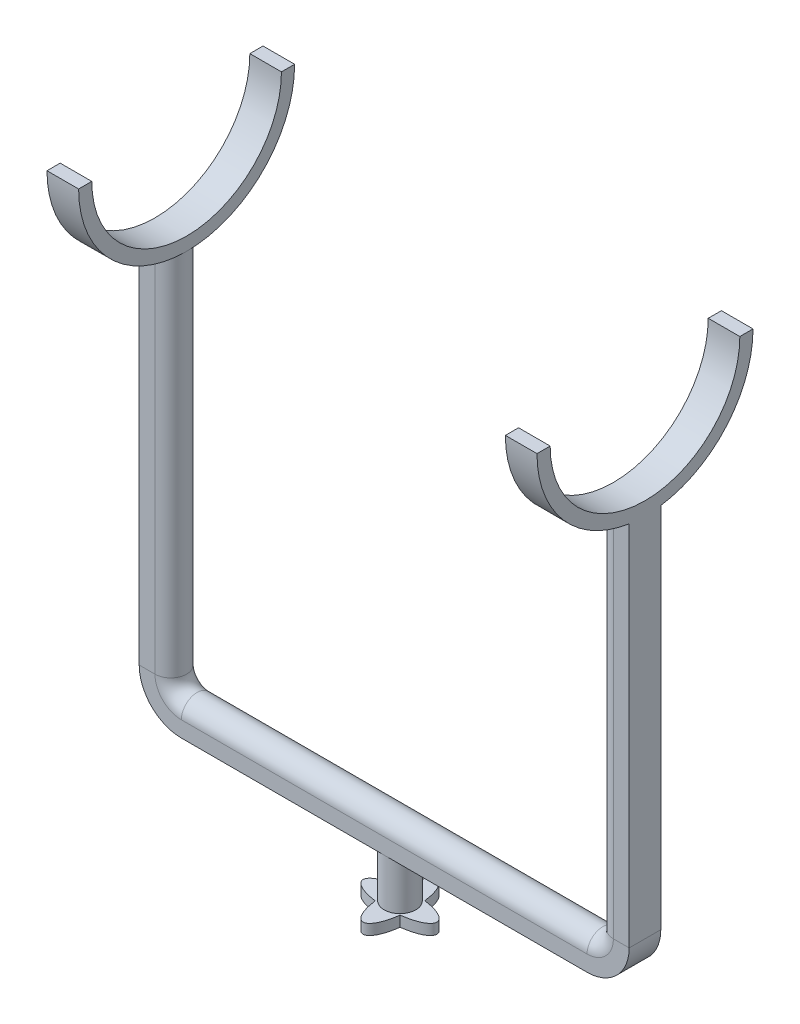
from build123d import *

# Parameters (mm, degrees)
BOSS_EXTRUDE3_DEPTH             = 2
SKETCH3_R                       = 3
BOSS_EXTRUDE4_DEPTH             = 9
BOSS_EXTRUDE5_DEPTH             = 38.5
BOSS_EXTRUDE5_DEPTH_BACK        = 38.5
SWEEP2_START                    = 11
SWEEP2_DEPTH                    = 78
SWEEP2_2_DEPTH                  = 8
SWEEP2_START_2                  = -4
SWEEP2_3_DEPTH                  = 8
SWEEP4_START                    = 11
SWEEP4_DEPTH                    = 78
SWEEP4_2_DEPTH                  = 8
SWEEP4_START_2                  = -4
SWEEP4_3_DEPTH                  = 8
BOSS_EXTRUDE6_DEPTH             = 3
BOSS_EXTRUDE6_DIRECTION_2_REACH = 128.768
BOSS_EXTRUDE7_DEPTH             = 3
BOSS_EXTRUDE7_DEPTH_BACK        = 3


with BuildPart() as part:
    # Sketch2 → Boss-Extrude3 (new body)
    with BuildSketch(Plane(origin=(0, 0, 0), x_dir=(1, 0, 0), z_dir=(0, 1, 0))):
        with BuildLine():
            add(Edge.make_bspline(
                [(-2.354354779, -2.354354779), (0, -20.812496246), (2.354354779, -2.354354779)],
                knots=[5.055412921, 5.055412921, 5.055412921, 7.510957694, 7.510957694, 7.510957694], degree=2, weights=[1, 0.336336397, 1]))
            add(Edge.make_bspline(
                [(2.354354779, -2.354354779), (20.812496246, 0), (2.354354779, 2.354354779)],
                knots=[1.913820267, 1.913820267, 1.913820267, 4.36936504, 4.36936504, 4.36936504], degree=2, weights=[1, 0.336336397, 1]))
            add(Edge.make_bspline(
                [(2.354354779, 2.354354779), (0, 20.812496246), (-2.354354779, 2.354354779)],
                knots=[1.913820267, 1.913820267, 1.913820267, 4.36936504, 4.36936504, 4.36936504], degree=2, weights=[1, 0.336336397, 1]))
            add(Edge.make_bspline(
                [(-2.354354779, 2.354354779), (-20.812496246, 0), (-2.354354779, -2.354354779)],
                knots=[5.055412921, 5.055412921, 5.055412921, 7.510957694, 7.510957694, 7.510957694], degree=2, weights=[1, 0.336336397, 1]))
        make_face()
    extrude(amount=BOSS_EXTRUDE3_DEPTH)

    # Sketch3 → Boss-Extrude4 (add)
    with BuildSketch(Plane(origin=(0, 2, 0), x_dir=(1, 0, 0), z_dir=(0, 1, 0))):
        with Locations(Location((0, 0, 0), (0, 0, 270))):
            Circle(SKETCH3_R)
    extrude(amount=BOSS_EXTRUDE4_DEPTH)

    # Sketch4 → Boss-Extrude5 (add, two sides: drawn at the far end of the back side and taken through both)
    with BuildSketch(Plane(origin=(0, 0, 0), x_dir=(0, 0, -1), z_dir=(1, 0, 0)).offset(-BOSS_EXTRUDE5_DEPTH_BACK)):
        with BuildLine():
            Line((3, 11), (-3, 11))
            Line((-3, 11), (-3, 14))
            ThreePointArc((-3, 14), (0, 17), (3, 14))
            Line((3, 14), (3, 11))
        make_face()
    extrude(amount=BOSS_EXTRUDE5_DEPTH + BOSS_EXTRUDE5_DEPTH_BACK)



with BuildPart() as body_2:
    # Sweep2: read off the stored shape, not the designer's step
    # Sweep2 outline → Sweep2 (new body)
    with BuildSketch(Plane(origin=(0, 0, 0), x_dir=(1, 0, 0), z_dir=(0, 1, 0)).offset(SWEEP2_START)):
        with BuildLine():
            Line((46.5, -3), (46.5, 3))
            Line((46.5, 3), (43.5, 3))
            ThreePointArc((43.5, 3), (40.5, 0), (43.5, -3))
            Line((43.5, -3), (46.5, -3))
        make_face()
    extrude(amount=SWEEP2_DEPTH)


with BuildPart() as part_1:
    add(part.part)

    add(body_2.part)  # Sweep2 2 merges body 2
    # Sweep2 2 outline → Sweep2 2 (add)
    with BuildSketch(Plane(origin=(0, 0, 0), x_dir=(1, 0, 0), z_dir=(0, 1, 0)).offset(SWEEP2_START)):
        with BuildLine():
            ThreePointArc((43.5, -3), (40.5, 0), (43.5, 3))
            Line((43.5, 3), (38.5, 3))
            Line((38.5, 3), (38.5, -3))
            Line((38.5, -3), (43.5, -3))
        make_face()
    extrude(amount=SWEEP2_2_DEPTH)

    # Sweep2 3 outline → Sweep2 3 (cut)
    with BuildSketch(Plane.XY.offset(SWEEP2_START_2)):
        with BuildLine():
            ThreePointArc((46.5, 19), (44.156854249, 13.343145751), (38.5, 11))
            Line((38.5, 11), (46.5, 11))
            Line((46.5, 11), (46.5, 19))
        make_face()
    extrude(amount=SWEEP2_3_DEPTH, mode=Mode.SUBTRACT)

    # Sweep2 4 outline → Sweep2 4 (revolve, cut)
    with BuildSketch(Plane(origin=(38.5, 19, 0), x_dir=(1, 0, 0), z_dir=(0, -1, 0))):
        with BuildLine():
            ThreePointArc((5, -3), (2, 0), (5, 3))
            Line((5, 3), (0, 3))
            Line((0, 3), (0, -3))
            Line((0, -3), (5, -3))
        make_face()
    revolve(axis=Axis((38.5, 19, 0), (0, 0, 1)), mode=Mode.SUBTRACT)



with BuildPart() as body_2_2:
    # Sweep4: read off the stored shape, not the designer's step
    # Sweep4 outline → Sweep4 (new body)
    with BuildSketch(Plane(origin=(0, 0, 0), x_dir=(1, 0, 0), z_dir=(0, 1, 0)).offset(SWEEP4_START)):
        with BuildLine():
            ThreePointArc((-43.5, -3), (-40.5, 0), (-43.5, 3))
            Line((-43.5, 3), (-46.5, 3))
            Line((-46.5, 3), (-46.5, -3))
            Line((-46.5, -3), (-43.5, -3))
        make_face()
    extrude(amount=SWEEP4_DEPTH)


with BuildPart() as part_2:
    add(part_1.part)

    add(body_2_2.part)  # Sweep4 2 merges body 2 2
    # Sweep4 2 outline → Sweep4 2 (add)
    with BuildSketch(Plane(origin=(0, 0, 0), x_dir=(1, 0, 0), z_dir=(0, 1, 0)).offset(SWEEP4_START)):
        with BuildLine():
            Line((-38.5, -3), (-38.5, 3))
            Line((-38.5, 3), (-43.5, 3))
            ThreePointArc((-43.5, 3), (-40.5, 0), (-43.5, -3))
            Line((-43.5, -3), (-38.5, -3))
        make_face()
    extrude(amount=SWEEP4_2_DEPTH)

    # Sweep4 3 outline → Sweep4 3 (cut)
    with BuildSketch(Plane.XY.offset(SWEEP4_START_2)):
        with BuildLine():
            Line((-46.5, 11), (-38.5, 11))
            ThreePointArc((-38.5, 11), (-44.156854249, 13.343145751), (-46.5, 19))
            Line((-46.5, 19), (-46.5, 11))
        make_face()
    extrude(amount=SWEEP4_3_DEPTH, mode=Mode.SUBTRACT)

    # Sweep4 4 outline → Sweep4 4 (revolve, cut)
    with BuildSketch(Plane(origin=(-38.5, 19, 0), x_dir=(1, 0, 0), z_dir=(0, -1, 0))):
        with BuildLine():
            Line((0, -3), (5, -3))
            ThreePointArc((5, -3), (2, 0), (5, 3))
            Line((5, 3), (0, 3))
            Line((0, 3), (0, -3))
        make_face()
    revolve(axis=Axis((-38.5, 19, 0), (0, 0, 1)), mode=Mode.SUBTRACT)

    # Sketch8 → Boss-Extrude6 (add)
    with BuildSketch(Plane(origin=(-43.5, 0, 0), x_dir=(0, 0, -1), z_dir=(1, 0, 0))):
        with BuildLine():
            Line((20.5, 109), (18, 109))
            ThreePointArc((18, 109), (0, 91), (-18, 109))
            Line((-18, 109), (-20.5, 109))
            ThreePointArc((-20.5, 109), (0, 88.5), (20.5, 109))
        make_face()
    extrude(amount=BOSS_EXTRUDE6_DEPTH)

    # Boss-Extrude6 direction 2: up to this face of the body (flat: up to its plane)
    boss_extrude6_direction_2_end = Plane(part_2.part.faces().sort_by_distance((-46.5, 54, 0))[0])
    # Sketch8 → Boss-Extrude6 direction 2 (add, up to the picked face)
    with BuildSketch(Plane(origin=(-43.5, 0, 0), x_dir=(0, 0, -1), z_dir=(1, 0, 0)), mode=Mode.PRIVATE) as boss_extrude6_direction_2_sk1:
        with BuildLine():
            Line((20.5, 109), (18, 109))
            ThreePointArc((18, 109), (0, 91), (-18, 109))
            Line((-18, 109), (-20.5, 109))
            ThreePointArc((-20.5, 109), (0, 88.5), (20.5, 109))
        make_face()
    boss_extrude6_direction_2_tool1 = split(extrude(boss_extrude6_direction_2_sk1.sketch, amount=-BOSS_EXTRUDE6_DIRECTION_2_REACH, mode=Mode.PRIVATE), bisect_by=boss_extrude6_direction_2_end, keep=Keep.BOTH, mode=Mode.PRIVATE)
    add(boss_extrude6_direction_2_tool1.solids().sort_by(Axis((-43.5, 108.541606, -19.25), (-1, 0, 0)))[0])

    # Sketch9 → Boss-Extrude7 (add, two sides: drawn at the far end of the back side and taken through both)
    with BuildSketch(Plane(origin=(43.5, 0, 0), x_dir=(0, 0, -1), z_dir=(1, 0, 0)).offset(-BOSS_EXTRUDE7_DEPTH_BACK)):
        with BuildLine():
            Line((-18, 109), (-20.5, 109))
            ThreePointArc((-20.5, 109), (0, 88.5), (20.5, 109))
            Line((20.5, 109), (18, 109))
            ThreePointArc((18, 109), (0, 91), (-18, 109))
        make_face()
    extrude(amount=BOSS_EXTRUDE7_DEPTH + BOSS_EXTRUDE7_DEPTH_BACK)


solid = part_2.part
